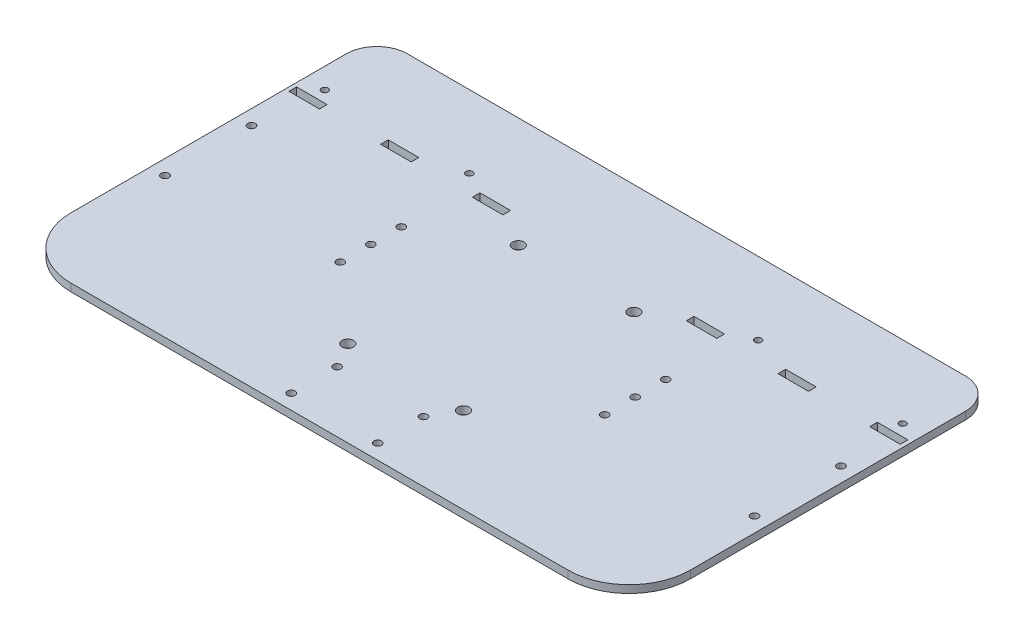
from build123d import *

# Parameters (mm, degrees)
SKETCH1_R           = 4.7625
SKETCH1_R_2         = 3.175
SKETCH1_R_3         = 2.794
SKETCH1_W           = 25.4
SKETCH1_H           = 6.35
BOSS_EXTRUDE1_DEPTH = 6.35


with BuildPart() as part:
    # Sketch1 → Boss-Extrude1 (new body)
    with BuildSketch(Plane(origin=(0, 0, 0), x_dir=(1, 0, 0), z_dir=(0, 1, 0))):
        with BuildLine():
            Line((50.8, 0), (463.677487426, 0))
            ThreePointArc((463.677487426, 0), (499.59851191, 14.878975516), (514.477487426, 50.8))
            Line((514.477487426, 50.8), (514.477487426, 279.4))
            ThreePointArc((514.477487426, 279.4), (507.037999668, 297.360512242), (489.077487426, 304.8))
            Line((489.077487426, 304.8), (25.4, 304.8))
            ThreePointArc((25.4, 304.8), (7.439487758, 297.360512242), (0, 279.4))
            Line((0, 279.4), (0, 50.8))
            ThreePointArc((0, 50.8), (14.878975516, 14.878975516), (50.8, 0))
        make_face()
        with Locations((305.32695, 213.055054)):
            Circle(SKETCH1_R, mode=Mode.SUBTRACT)
        with Locations((305.32695, 71.425054)):
            Circle(SKETCH1_R, mode=Mode.SUBTRACT)
        with Locations((502.173875, 116.4574125)):
            Circle(SKETCH1_R_2, mode=Mode.SUBTRACT)
        with Locations((502.173875, 188.2917875)):
            Circle(SKETCH1_R_2, mode=Mode.SUBTRACT)
        with Locations((12.303125, 116.4574125)):
            Circle(SKETCH1_R_2, mode=Mode.SUBTRACT)
        with Locations((12.303125, 188.2917875)):
            Circle(SKETCH1_R_2, mode=Mode.SUBTRACT)
        with Locations((209.27695, 71.425054)):
            Circle(SKETCH1_R, mode=Mode.SUBTRACT)
        with Locations((209.27695, 213.055054)):
            Circle(SKETCH1_R, mode=Mode.SUBTRACT)
        with Locations((221.3848125, 50.403125)):
            Circle(SKETCH1_R_2, mode=Mode.SUBTRACT)
        with Locations((221.3848125, 12.303125)):
            Circle(SKETCH1_R_2, mode=Mode.SUBTRACT)
        with Locations((293.2191875, 50.403125)):
            Circle(SKETCH1_R_2, mode=Mode.SUBTRACT)
        with Locations((293.2191875, 12.303125)):
            Circle(SKETCH1_R_2, mode=Mode.SUBTRACT)
        with Locations((147.3962, 177.7746)):
            Circle(SKETCH1_R_2, mode=Mode.SUBTRACT)
        with Locations((147.3962, 126.9746)):
            Circle(SKETCH1_R_2, mode=Mode.SUBTRACT)
        with Locations((147.3962, 152.3746)):
            Circle(SKETCH1_R_2, mode=Mode.SUBTRACT)
        with Locations((367.081287426, 152.3746)):
            Circle(SKETCH1_R_2, mode=Mode.SUBTRACT)
        with Locations((367.081287426, 126.9746)):
            Circle(SKETCH1_R_2, mode=Mode.SUBTRACT)
        with Locations((367.081287426, 177.7746)):
            Circle(SKETCH1_R_2, mode=Mode.SUBTRACT)
        with Locations((497.175487426, 244.4496)):
            Circle(SKETCH1_R_3, mode=Mode.SUBTRACT)
        with Locations((377.175487426, 244.4496)):
            Circle(SKETCH1_R_3, mode=Mode.SUBTRACT)
        with Locations((137.175487426, 244.4496)):
            Circle(SKETCH1_R_3, mode=Mode.SUBTRACT)
        with Locations((17.175487426, 244.4496)):
            Circle(SKETCH1_R_3, mode=Mode.SUBTRACT)
        with Locations((498.475487426, 231.7496)):
            Rectangle(SKETCH1_W, SKETCH1_H, mode=Mode.SUBTRACT)
        with Locations((422.275487426, 231.7496)):
            Rectangle(SKETCH1_W, SKETCH1_H, mode=Mode.SUBTRACT)
        with Locations((346.075487426, 231.7496)):
            Rectangle(SKETCH1_W, SKETCH1_H, mode=Mode.SUBTRACT)
        with Locations((168.275487426, 231.7496)):
            Rectangle(SKETCH1_W, SKETCH1_H, mode=Mode.SUBTRACT)
        with Locations((92.075487426, 231.7496)):
            Rectangle(SKETCH1_W, SKETCH1_H, mode=Mode.SUBTRACT)
        with Locations((15.875487426, 231.7496)):
            Rectangle(SKETCH1_W, SKETCH1_H, mode=Mode.SUBTRACT)
    extrude(amount=BOSS_EXTRUDE1_DEPTH)


solid = part.part
